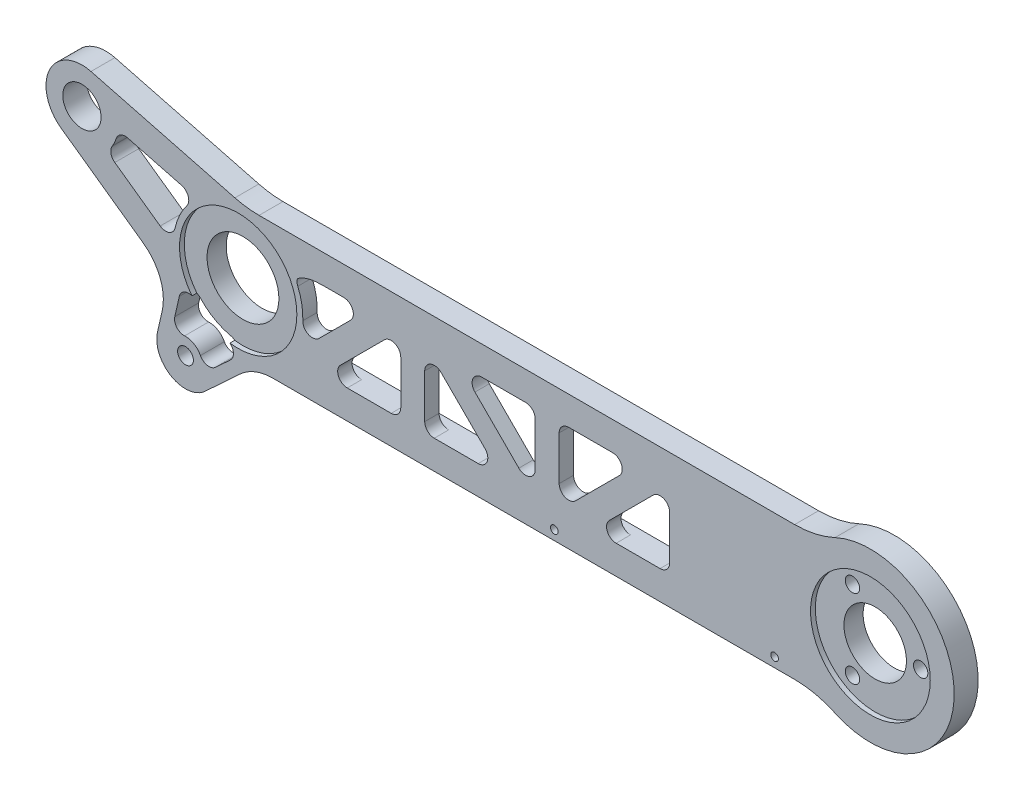
from build123d import *

# Parameters (mm, degrees)
EXTRUDE_1_DEPTH      = 5
SKETCH_2_R           = 4
CUT_EXTRUDE_1_DEPTH  = 5
SKETCH_3_R           = 7.5
CUT_EXTRUDE_2_DEPTH  = 10
CUT_EXTRUDE_START    = -10
CUT_EXTRUDE_3_DEPTH  = 10
CUT_EXTRUDE_4_DEPTH  = 10
FILLET_1_R           = 2
SKETCH_6_R           = 6.525
CUT_EXTRUDE_5_DEPTH  = 10
SKETCH_8_R           = 1.5
CUT_EXTRUDE_7_DEPTH  = 10
SKETCH_11_R          = 0.8
CUT_EXTRUDE_8_DEPTH  = 10
SKETCH_13_R          = 1.65
EXTRUDE_3_DEPTH      = 5
FILLET_3_R           = 10
CUT_EXTRUDE_9_DEPTH  = 5
SKETCH_16_W          = 48
SKETCH_16_H          = 16
SKETCH_16_W_2        = 50
CUT_EXTRUDE_10_DEPTH = 2
FILLET_4_SIZE        = 8
SKETCH_17_R          = 12.5
SKETCH_17_R_2        = 12.25
CUT_EXTRUDE_11_DEPTH = 1


with BuildPart() as part:
    # 草图1 → 凸台-拉伸1 (new body)
    with BuildSketch(Plane.XY):
        with BuildLine():
            Line((-30.736828822, 22.472146181), (-0.685809887, 14.645629979))
            ThreePointArc((-0.685809887, 14.645629979), (1.813935823, 14.162064114), (4.35486081, 14))
            Line((4.35486081, 14), (116.18070798, 14))
            ThreePointArc((116.18070798, 14), (120.501201779, 14.472241979), (124.617663724, 15.866666667))
            ThreePointArc((124.617663724, 15.866666667), (149.5, 0), (124.617663724, -15.866666667))
            ThreePointArc((124.617663724, -15.866666667), (120.501201779, -14.472241979), (116.18070798, -14))
            Line((116.18070798, -14), (0, -14))
            ThreePointArc((0, -14), (-4.256709716, -13.337181951), (-8.110358856, -11.411488914))
            Line((-8.110358856, -11.411488914), (-36.971915435, 9.10095979))
            ThreePointArc((-36.971915435, 9.10095979), (-39.424388736, 18.383894386), (-30.736828822, 22.472146181))
        make_face()
    extrude(amount=EXTRUDE_1_DEPTH)

    # 草图2 → 切除-拉伸1 (cut)
    with BuildSketch(Plane.XY.offset(5)):
        with Locations((-32.627080333, 15.214257423)):
            Circle(SKETCH_2_R)
    extrude(amount=-CUT_EXTRUDE_1_DEPTH, mode=Mode.SUBTRACT)

    # 草图3 → 切除-拉伸2 (cut)
    with BuildSketch(Plane.XY.offset(5)):
        Circle(SKETCH_3_R)
    extrude(amount=-CUT_EXTRUDE_2_DEPTH, mode=Mode.SUBTRACT)

    # 草图4 → 切除-拉伸3 (cut)
    with BuildSketch(Plane.XY.offset(5).offset(CUT_EXTRUDE_START)):
        with BuildLine():
            ThreePointArc((-13.498186757, -0.221256097), (-12.235155125, 5.705346533), (-8.506975197, 10.482431635))
            Line((-8.506975197, 10.482431635), (-25.137780404, 14.813774499))
            ThreePointArc((-25.137780404, 14.813774499), (-25.829771931, 12.04462046), (-27.506263415, 9.73454629))
            Line((-27.506263415, 9.73454629), (-13.498186757, -0.221256097))
        make_face()
    extrude(amount=CUT_EXTRUDE_3_DEPTH, mode=Mode.SUBTRACT)

    # 草图5 → 切除-拉伸4 (cut)
    with BuildSketch(Plane.XY.offset(5).offset(CUT_EXTRUDE_START)):
        Polygon((33.945349397, 8), (17.945349397, -8), (33.945349397, -8), align=None)
        with BuildLine():
            ThreePointArc((13.5, 0), (12.826784504, -4.209940534), (10.874281585, -8))
            Line((10.874281585, -8), (26.874281585, 8))
            Line((26.874281585, 8), (10.874281585, 8))
            ThreePointArc((10.874281585, 8), (12.826784504, 4.209940534), (13.5, 0))
        make_face()
        Polygon((54.945349397, -8), (38.945349397, 8), (38.945349397, -8), align=None)
        Polygon((62.016417209, 8), (46.016417209, 8), (62.016417209, -8), align=None)
        Polygon((83.016417209, 8), (67.016417209, 8), (67.016417209, -8), align=None)
        Polygon((90.087485021, 8), (74.087485021, -8), (90.087485021, -8), align=None)
    extrude(amount=CUT_EXTRUDE_4_DEPTH, mode=Mode.SUBTRACT)

    # 圆角1
    fillet_1_edges = [part.edges().sort_by_distance(p)[0] for p in [
        (38.945349397, 8, 2.5),
        (54.945349397, -8, 2.5),
        (38.945349397, -8, 2.5),
        (10.874281585, -8, 2.5),
        (10.874281585, 8, 2.5),
        (26.874281585, 8, 2.5),
        (90.087485021, 8, 2.5),
        (90.087485021, -8, 2.5),
        (74.087485021, -8, 2.5),
        (17.945349397, -8, 2.5),
        (33.945349397, 8, 2.5),
        (33.945349397, -8, 2.5),
        (-27.506263415, 9.73454629, 2.5),
        (-25.137780404, 14.813774499, 2.5),
        (-8.506975197, 10.482431635, 2.5),
        (-13.498186757, -0.221256097, 2.5),
        (67.016417209, -8, 2.5),
        (67.016417209, 8, 2.5),
        (83.016417209, 8, 2.5),
        (62.016417209, -8, 2.5),
        (46.016417209, 8, 2.5),
        (62.016417209, 8, 2.5),
    ]]
    fillet(fillet_1_edges, radius=FILLET_1_R)

    # 草图6 → 切除-拉伸5 (cut)
    with BuildSketch(Plane.XY.offset(5)):
        with Locations((132, 0)):
            Circle(SKETCH_6_R)
    extrude(amount=-CUT_EXTRUDE_5_DEPTH, mode=Mode.SUBTRACT)

    # 草图8 → 切除-拉伸7 (cut)
    with BuildSketch(Plane.XY.offset(5)):
        with Locations((141.5, 0)):
            Circle(SKETCH_8_R)
        with Locations((127.25, -8.227241336)):
            Circle(SKETCH_8_R)
        with Locations((127.25, 8.227241336)):
            Circle(SKETCH_8_R)
    extrude(amount=-CUT_EXTRUDE_7_DEPTH, mode=Mode.SUBTRACT)

    # 草图11 → 切除-拉伸8 (cut)
    with BuildSketch(Plane.XY.offset(5)):
        with Locations((66, -12)):
            Circle(SKETCH_11_R)
        with Locations((112, -12)):
            Circle(SKETCH_11_R)
    extrude(amount=-CUT_EXTRUDE_8_DEPTH, mode=Mode.SUBTRACT)

    # 草图13 → 凸台-拉伸3 (add)
    with BuildSketch(Plane(origin=(0, 0, 0), x_dir=(-1, 0, 0), z_dir=(0, 0, -1))):
        with BuildLine():
            Line((13.852186046, -4.540588259), (-8.101408935, -9.534449379))
            Line((-8.101408935, -9.534449379), (6.922184096, -23.45385613))
            ThreePointArc((6.922184096, -23.45385613), (14, -24.248711306), (16.850543177, -17.721715341))
            Line((16.850543177, -17.721715341), (13.852186046, -4.540588259))
        make_face()
        with Locations((11, -19.052558883)):
            Circle(SKETCH_13_R, mode=Mode.SUBTRACT)
    extrude(amount=-EXTRUDE_3_DEPTH)

    # 圆角3
    fillet_3_edges = [part.edges().sort_by_distance(p)[0] for p in [
        (3.281619098, -14, 2.5),
        (-14.398527657, -6.942369598, 2.5),
    ]]
    fillet(fillet_3_edges, radius=FILLET_3_R)

    # 草图15 → 切除-拉伸9 (cut)
    with BuildSketch(Plane(origin=(0, 0, 0), x_dir=(-1, 0, 0), z_dir=(0, 0, -1))):
        with BuildLine():
            Line((1.631482745, -15.143918385), (4.739694736, -18.023686685))
            ThreePointArc((4.739694736, -18.023686685), (6.449635066, -18.525605556), (7.88116063, -17.464213523))
            ThreePointArc((7.88116063, -17.464213523), (9.25, -16.02146997), (11.183872253, -15.557392078))
            ThreePointArc((11.183872253, -15.557392078), (12.818827499, -14.848350591), (13.239123171, -13.11653939))
            Line((13.239123171, -13.11653939), (12.299276662, -8.984864696))
            ThreePointArc((12.299276662, -8.984864696), (10.858631775, -7.494474843), (8.870653374, -8.081553608))
            ThreePointArc((8.870653374, -8.081553608), (6, -10.392304845), (2.56350404, -11.722987974))
            ThreePointArc((2.56350404, -11.722987974), (1.061089715, -13.151088389), (1.631482745, -15.143918385))
        make_face()
    extrude(amount=-CUT_EXTRUDE_9_DEPTH, mode=Mode.SUBTRACT)

    # 草图16 → 切除-拉伸10 (cut)
    with BuildSketch(Plane(origin=(0, 0, 0), x_dir=(-1, 0, 0), z_dir=(0, 0, -1))):
        with Locations((-84.267784395, 0)):
            Rectangle(SKETCH_16_W, SKETCH_16_H)
        with Locations((-35.267784395, 0)):
            Rectangle(SKETCH_16_W_2, SKETCH_16_H)
    extrude(amount=-CUT_EXTRUDE_10_DEPTH, mode=Mode.SUBTRACT)

    # 圆角4
    # a fillet whose section is not a circle: 8 mm, written as the material it adds along each edge
    with BuildSketch(Plane(origin=(108.267784395, 8, 0), x_dir=(-1, 0, 0), z_dir=(0, 0, 1)), Plane(origin=(108.267784395, -8, 0), x_dir=(0, 1, 0), z_dir=(0, 0, 1))) as fillet_4_piece_1:
        with BuildLine():
            add(Edge.make_bspline([(FILLET_4_SIZE, 0), (FILLET_4_SIZE * 0.831801948466, 0), (FILLET_4_SIZE * 0.663603896932, 0), (FILLET_4_SIZE * 0.292893218813, FILLET_4_SIZE * 0.0716919198361), (FILLET_4_SIZE * 0.0716919198361, FILLET_4_SIZE * 0.292893218813), (0, FILLET_4_SIZE * 0.663603896932), (0, FILLET_4_SIZE * 0.831801948466), (0, FILLET_4_SIZE)], knots=[0, 0, 0, 0, 0, 0, 0.5, 0.5, 1, 1, 1, 1, 1, 1], degree=5))
            Line((0, FILLET_4_SIZE), (0, 0))
            Line((0, 0), (FILLET_4_SIZE, 0))
        make_face()
    extrude(amount=2)
    with BuildSketch(Plane(origin=(10.267784395, -8, 0), x_dir=(0, 1, 0), z_dir=(0, 0, 1))) as fillet_4_piece_2:
        with BuildLine():
            add(Edge.make_bspline([(FILLET_4_SIZE, 0), (FILLET_4_SIZE * 0.831801948466, 0), (FILLET_4_SIZE * 0.663603896932, 0), (FILLET_4_SIZE * 0.292893218813, -FILLET_4_SIZE * 0.0716919198361), (FILLET_4_SIZE * 0.0716919198361, -FILLET_4_SIZE * 0.292893218813), (0, -FILLET_4_SIZE * 0.663603896932), (0, -FILLET_4_SIZE * 0.831801948466), (0, -FILLET_4_SIZE)], knots=[0, 0, 0, 0, 0, 0, 0.5, 0.5, 1, 1, 1, 1, 1, 1], degree=5))
            Line((0, -FILLET_4_SIZE), (0, 0))
            Line((0, 0), (FILLET_4_SIZE, 0))
        make_face()
    extrude(amount=2)
    with BuildSketch(Plane(origin=(10.267784395, 8, 0), x_dir=(0, -1, 0), z_dir=(0, 0, 1))) as fillet_4_piece_3_section:
        with BuildLine():
            add(Edge.make_bspline([(FILLET_4_SIZE, 0), (FILLET_4_SIZE * 0.831801948466, 0), (FILLET_4_SIZE * 0.663603896932, 0), (FILLET_4_SIZE * 0.292893218813, FILLET_4_SIZE * 0.0716919198361), (FILLET_4_SIZE * 0.0716919198361, FILLET_4_SIZE * 0.292893218813), (0, FILLET_4_SIZE * 0.663603896932), (0, FILLET_4_SIZE * 0.831801948466), (0, FILLET_4_SIZE)], knots=[0, 0, 0, 0, 0, 0, 0.5, 0.5, 1, 1, 1, 1, 1, 1], degree=5))
            Line((0, FILLET_4_SIZE), (0, 0))
            Line((0, 0), (FILLET_4_SIZE, 0))
        make_face()
    fillet_4_piece_3 = extrude(amount=22, mode=Mode.PRIVATE)
    fillet_4_piece_3 = split(fillet_4_piece_3, bisect_by=Plane(origin=(10.267784395, 8, 5), z_dir=(0, 0, -1)), keep=Keep.TOP, mode=Mode.PRIVATE)
    add(fillet_4_piece_3)

    # 草图17 → 切除-拉伸11 (cut)
    with BuildSketch(Plane.XY.offset(5)):
        with Locations((132, 0)):
            Circle(SKETCH_17_R)
        Circle(SKETCH_17_R_2)
    extrude(amount=-CUT_EXTRUDE_11_DEPTH, mode=Mode.SUBTRACT)


solid = part.part
